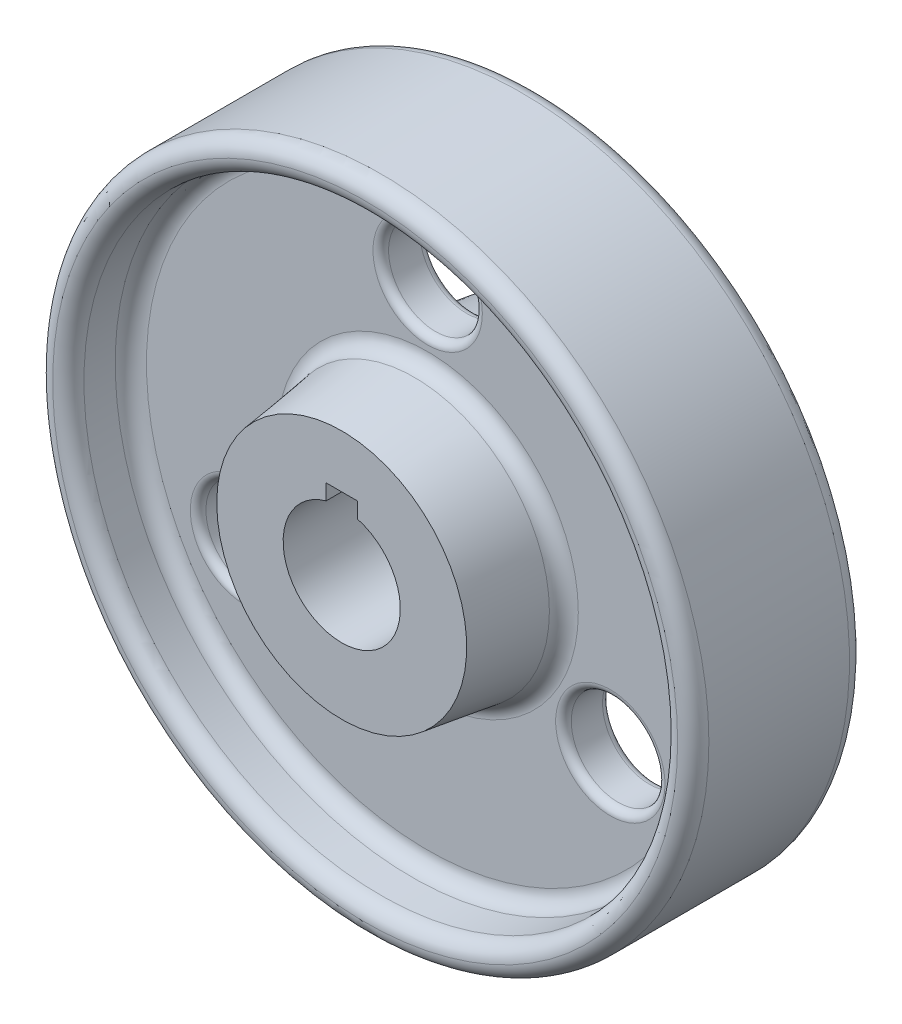
from build123d import *

# Parameters (mm, degrees)
DIAM_TRE_DU_PER_AGE_3_4_0_75_2_D = 19.05
R_P_TITION_CIRCULAIRE1_COUNT     = 3
CONG_1_R                         = 1.5875
CONG_2_R                         = 3.175
CONG_3_R                         = 3.175
ESQUISSE4_W                      = 6.35
ESQUISSE4_H                      = 3.175
ENL_V_MAT_EXTRU_1_DEPTH          = 105.244490326


with BuildPart() as part:
    # Esquisse1 → Base-Révolution (revolve)
    with BuildSketch(Plane(origin=(0, 0, 0), x_dir=(0, 0, -1), z_dir=(1, 0, 0)), mode=Mode.PRIVATE) as base_r_volution_sk:
        Polygon((-22.225, 11.90625), (22.225, 11.90625), (22.225, 25.4), (4.7625, 27.854194326), (4.7625, 60.325), (17.4625, 60.325), (17.4625, 66.675), (-17.4625, 66.675), (-17.4625, 60.325), (-4.7625, 60.325), (-4.7625, 27.854194326), (-22.225, 25.4), align=None)
    revolve(base_r_volution_sk.sketch.rotate(Axis((0, 0, 60), (0, 0, -1)), 270), axis=Axis((0, 0, 60), (0, 0, -1)))

    # Diamètre du perçage 3/4 (0.75)2 (through all)
    with Locations(Plane.XY.offset(4.7625)):
        with Locations((0, 42.8625)):
            diam_tre_du_per_age_3_4_0_75_2 = Hole(DIAM_TRE_DU_PER_AGE_3_4_0_75_2_D / 2)

    # Répétition circulaire1: Diamètre du perçage 3/4 (0.75)2 ×3 about axis
    r_p_tition_circulaire1_axis = Axis((0, 0, 0), (0, 0, 1))
    for i in range(1, R_P_TITION_CIRCULAIRE1_COUNT):
        add(diam_tre_du_per_age_3_4_0_75_2.rotate(r_p_tition_circulaire1_axis, i * 360 / R_P_TITION_CIRCULAIRE1_COUNT), mode=Mode.SUBTRACT)

    # Congé1
    cong_1_edges = [part.edges().sort_by_distance(p)[0] for p in [
        (9.525, 42.8625, -4.7625),
        (9.525, 42.8625, 4.7625),
        (-41.88251387, -13.182358029, -4.7625),
        (-41.88251387, -13.182358029, 4.7625),
        (32.35751387, -29.680141971, -4.7625),
        (32.35751387, -29.680141971, 4.7625),
    ]]
    fillet(cong_1_edges, radius=CONG_1_R)

    # Congé2
    cong_2_edges = [part.edges().sort_by_distance(p)[0] for p in [
        (60.325, 0, -4.7625),
        (60.325, 0, -17.4625),
        (60.325, 0, 17.4625),
        (60.325, 0, 4.7625),
        (27.854194326, 0, 4.7625),
        (27.854194326, 0, -4.7625),
    ]]
    fillet(cong_2_edges, radius=CONG_2_R)

    # Congé3
    cong_3_edges = [part.edges().sort_by_distance(p)[0] for p in [
        (66.675, 0, -17.4625),
        (66.675, 0, 17.4625),
    ]]
    fillet(cong_3_edges, radius=CONG_3_R - 0.0001)  # a hair under: the kernel refuses the full size

    # Esquisse4 → Enlèv. mat.-Extru.1 (cut, through all)
    with BuildSketch(Plane.XY.offset(22.225)):
        with Locations((0, 13.062610634)):
            Rectangle(ESQUISSE4_W, ESQUISSE4_H)
    extrude(amount=-ENL_V_MAT_EXTRU_1_DEPTH, mode=Mode.SUBTRACT)


solid = part.part
